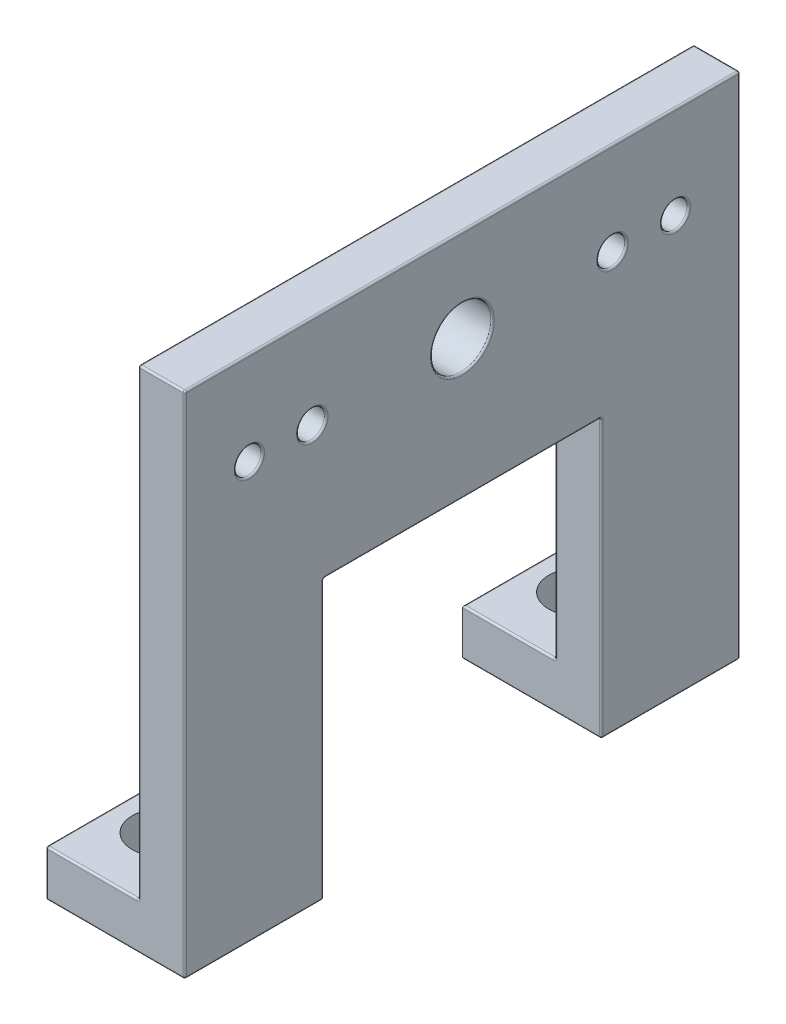
from build123d import *

# Parameters (mm, degrees)
BOSS_EXTRUDE1_DEPTH = 60
SKETCH2_R           = 3.25
SKETCH2_R_2         = 1.435
SKETCH2_R_3         = 1.5
CUT_EXTRUDE1_DEPTH  = 83.764726786
CUT_EXTRUDE2_START  = -15
CUT_EXTRUDE2_DEPTH  = 30
FILLET16_R          = 0.2
SKETCH4_R           = 3.175
CUT_EXTRUDE3_DEPTH  = 80.529868603


with BuildPart() as part:
    # Sketch1 → Boss-Extrude1 (new body)
    with BuildSketch(Plane.XY):
        Polygon((0, 0), (15, 0), (15, 5), (15, 55), (10, 55), (10, 5), (0, 5), align=None)
    extrude(amount=BOSS_EXTRUDE1_DEPTH)

    # Sketch2 → Cut-Extrude1 (cut, through all)
    with BuildSketch(Plane(origin=(15, 0, 0), x_dir=(0, 0, -1), z_dir=(1, 0, 0))):
        with Locations((-30, 45)):
            Circle(SKETCH2_R)
        with Locations((-53.0125, 45)):
            Circle(SKETCH2_R_2)
        with Locations((-46.215, 45)):
            Circle(SKETCH2_R_3)
        with Locations((-13.785, 45)):
            Circle(SKETCH2_R_3)
        with Locations((-6.9875, 45)):
            Circle(SKETCH2_R_2)
    extrude(amount=-CUT_EXTRUDE1_DEPTH, mode=Mode.SUBTRACT)

    # Sketch3 → Cut-Extrude2 (cut)
    with BuildSketch(Plane(origin=(0, 0, 0), x_dir=(-1, 0, 0), z_dir=(0, 0, -1)).offset(CUT_EXTRUDE2_START)):
        Polygon((-15, 30), (-10, 30), (-10, 5), (0, 5), (0, 0), (-15, 0), align=None)
    extrude(amount=-CUT_EXTRUDE2_DEPTH, mode=Mode.SUBTRACT)

    # Fillet16
    fillet16_edges = [part.edges().sort_by_distance(p)[0] for p in [
        (5, 5, 15),
        (0, 5, 7.5),
        (0, 5, 52.5),
        (5, 5, 45),
        (12.5, 30, 45),
        (12.5, 30, 15),
        (0, 0, 52.5),
        (7.5, 0, 45),
        (0, 0, 7.5),
        (7.5, 0, 15),
        (5, 5, 60),
        (12.5, 55, 60),
        (7.5, 0, 60),
        (0, 2.5, 60),
        (7.5, 0, 0),
        (12.5, 55, 0),
        (5, 5, 0),
        (0, 2.5, 0),
        (15, 0, 52.5),
        (15, 27.5, 60),
        (15, 55, 30),
        (15, 27.5, 0),
        (15, 0, 7.5),
        (15, 15, 15),
        (15, 30, 30),
        (15, 15, 45),
        (15, 45, 8.4225),
        (15, 45, 15.285),
        (15, 45, 47.715),
        (15, 45, 54.4475),
        (15, 45, 33.25),
        (10, 30, 30),
        (10, 17.5, 15),
        (10, 5, 7.5),
        (10, 30, 0),
        (10, 55, 30),
        (10, 30, 60),
        (10, 5, 52.5),
        (10, 17.5, 45),
        (10, 45, 8.4225),
        (10, 45, 15.285),
        (10, 45, 47.715),
        (10, 45, 54.4475),
        (10, 45, 33.25),
    ]]
    fillet(fillet16_edges, radius=FILLET16_R)

    # Sketch4 → Cut-Extrude3 (cut, through all)
    with BuildSketch(Plane(origin=(0, 5, 0), x_dir=(1, 0, 0), z_dir=(0, 1, 0))):
        with Locations((5, -7.5)):
            Circle(SKETCH4_R)
        with Locations((5, -52.5)):
            Circle(SKETCH4_R)
    extrude(amount=-CUT_EXTRUDE3_DEPTH, mode=Mode.SUBTRACT)


solid = part.part
